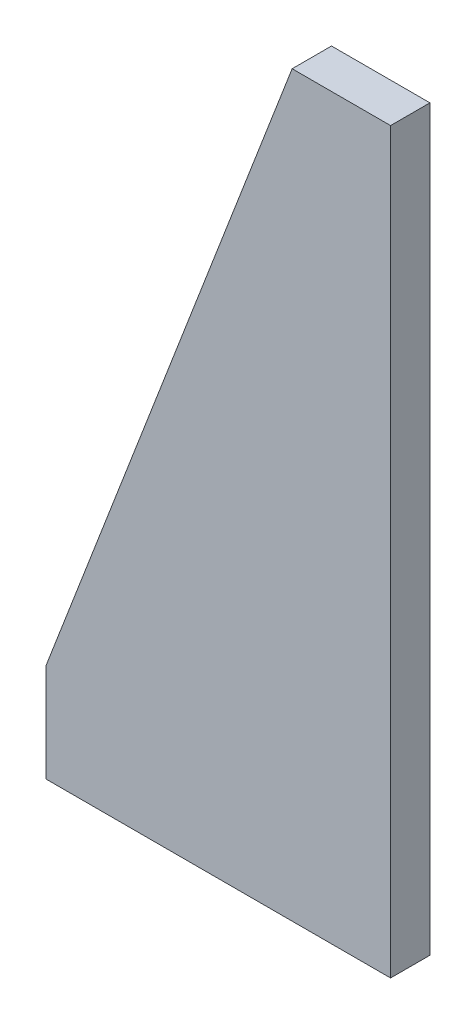
from build123d import *

# Parameters (mm, degrees)
SM_BASE_FLANGE_1_DEPTH = 8


# Sheet-metal steps are written as plain solids
with BuildPart() as part:
    # Sketch 1 → Базовая кромка1 (new body)
    with BuildSketch(Plane.XY):
        Polygon((50, 150), (0, 20), (0, 0), (70, 0), (70, 150), align=None)
    extrude(amount=-SM_BASE_FLANGE_1_DEPTH)


solid = part.part
